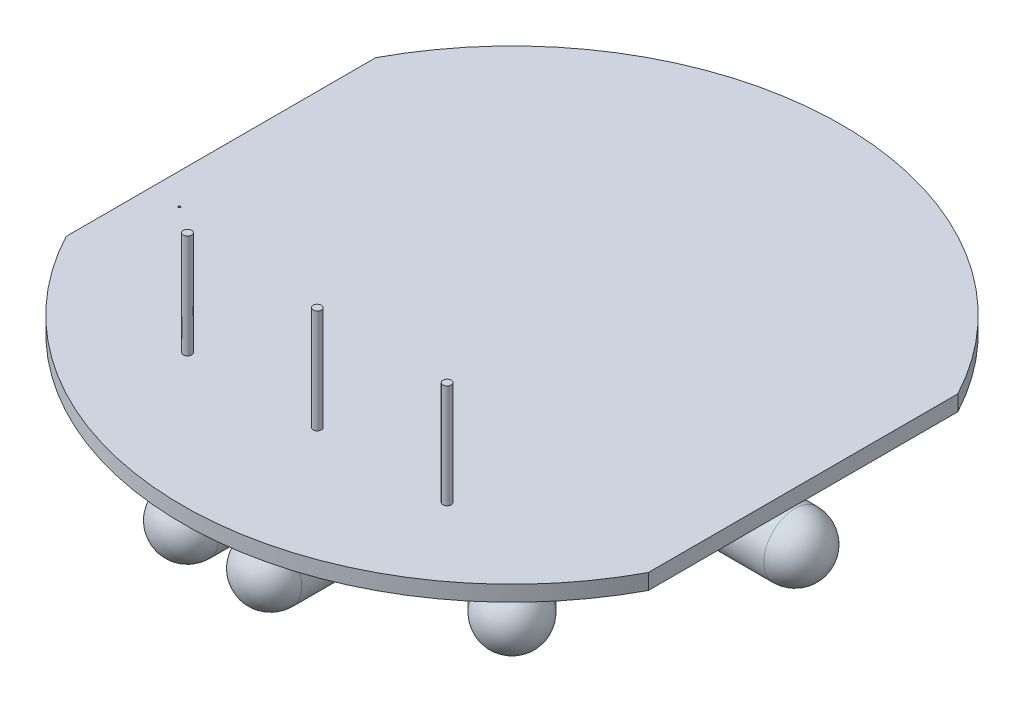
from build123d import *

# Parameters (mm, degrees)
SKETCH1_R        = 0.1075
BASE_DEPTH       = 1.5
SKETCH2_W        = 12.5
SKETCH2_H        = 4
MOTOR_BOX_DEPTH  = 4
FRONT_LEDS_COUNT = 2
FRONT_LEDS_PITCH = 8
SKETCH7_R        = 0.4
ANTENNAE_DEPTH   = 10


with BuildPart() as part:
    # Sketch1 → Base (new body)
    with BuildSketch(Plane(origin=(0, 0, 0), x_dir=(1, 0, 0), z_dir=(0, 1, 0))):
        with BuildLine():
            Line((-28.033586073, 14.905722118), (-28.033586073, -14.905722118))
            ThreePointArc((-28.033586073, -14.905722118), (0, -31.75), (28.033586073, -14.905722118))
            Line((28.033586073, -14.905722118), (28.033586073, 14.905722118))
            ThreePointArc((28.033586073, 14.905722118), (0, 31.75), (-28.033586073, 14.905722118))
        make_face()
        with Locations(Location((-25.04971545, -6.985, 0), (0, 0, 270))):
            Circle(SKETCH1_R, mode=Mode.SUBTRACT)
    extrude(amount=BASE_DEPTH)

    # Sketch2 → Motor Box (add)
    with BuildSketch(Plane.XZ):
        with Locations((0, 11.43)):
            Rectangle(SKETCH2_W, SKETCH2_H)
    extrude(amount=MOTOR_BOX_DEPTH)

    # Sketch7 → Antennae (add)
    with BuildSketch(Plane(origin=(0, 1.5, 0), x_dir=(-1, 0, 0), z_dir=(0, 1, 0))):
        with Locations(Location((0, 18.75, 0), (0, 0, 90))):
            Circle(SKETCH7_R)
        with Locations(Location((-12.5, 18.75, 0), (0, 0, 90))):
            Circle(SKETCH7_R)
        with Locations(Location((12.5, 18.75, 0), (0, 0, 90))):
            Circle(SKETCH7_R)
    extrude(amount=ANTENNAE_DEPTH)


with BuildPart() as body_2:
    # Sketch4 → LED (revolve)
    with BuildSketch(Plane(origin=(0, -4, 0), x_dir=(-1, 0, 0), z_dir=(0, 1, 0))):
        with BuildLine():
            Line((0, -21.75), (0, -30.25))
            ThreePointArc((0, -30.25), (-2.121320344, -29.371320344), (-3, -27.25))
            Line((-3, -27.25), (-3, -21.75))
            Line((-3, -21.75), (0, -21.75))
        make_face()
    revolve(axis=Axis((0, -4, -21.75), (0, 0, -1)))


with BuildPart() as body_3:
    # LED Pattern: read off the stored shape, not the designer's step
    # LED Pattern outline → LED Pattern (revolve)
    with BuildSketch(Plane(origin=(0, -4, 0), x_dir=(0.707106781186556, 0, -0.707106781186539), z_dir=(0, -1, 0))):
        with BuildLine():
            Line((3, -21.75), (0, -21.75))
            Line((0, -21.75), (0, -30.25))
            ThreePointArc((0, -30.25), (2.121320345, -29.371320342), (3, -27.249999997))
            Line((3, -27.249999997), (3, -21.75))
        make_face()
    revolve(axis=Axis((0, -4, 0), (0.707106781186539, 0, 0.707106781186556)))


with BuildPart() as body_4:
    # LED Pattern 2 outline → LED Pattern 2 (revolve)
    with BuildSketch(Plane(origin=(0, -4, 0), x_dir=(0, 1, 0), z_dir=(0, 0, -1))):
        with BuildLine():
            Line((3, -21.75), (0, -21.75))
            Line((0, -21.75), (0, -30.25))
            ThreePointArc((0, -30.25), (2.121320345, -29.371320342), (3, -27.249999997))
            Line((3, -27.249999997), (3, -21.75))
        make_face()
    revolve(axis=Axis((0, -4, 0), (1, 0, 0)))


with BuildPart() as body_5:
    # LED Pattern 3 outline → LED Pattern 3 (revolve)
    with BuildSketch(Plane(origin=(0, -4, 0), x_dir=(0.707106781186541, 0, 0.707106781186554), z_dir=(0, 1, 0))):
        with BuildLine():
            Line((3, -21.75), (0, -21.75))
            Line((0, -21.75), (0, -30.25))
            ThreePointArc((0, -30.25), (2.121320345, -29.371320342), (3, -27.249999997))
            Line((3, -27.249999997), (3, -21.75))
        make_face()
    revolve(axis=Axis((0, -4, 0), (0.707106781186554, 0, -0.707106781186541)))


with BuildPart() as body_6:
    # LED Pattern 4 outline → LED Pattern 4 (revolve)
    with BuildSketch(Plane(origin=(0, -4, 0), x_dir=(0.7071067811865509, 0, -0.707106781186544), z_dir=(0, -1, 0))):
        with BuildLine():
            Line((0, 30.25), (0, 21.75))
            Line((0, 21.75), (3, 21.75))
            Line((3, 21.75), (3, 27.249999997))
            ThreePointArc((3, 27.249999997), (2.121320345, 29.371320342), (0, 30.25))
        make_face()
    revolve(axis=Axis((0, -4, 0), (0.707106781186544, 0, 0.7071067811865509)))


with BuildPart() as body_7:
    # LED Pattern 5 outline → LED Pattern 5 (revolve)
    with BuildSketch(Plane(origin=(0, -4, 0), x_dir=(0, 1, 0), z_dir=(0, 0, -1))):
        with BuildLine():
            Line((0, 30.25), (0, 21.75))
            Line((0, 21.75), (3, 21.75))
            Line((3, 21.75), (3, 27.249999997))
            ThreePointArc((3, 27.249999997), (2.121320345, 29.371320342), (0, 30.25))
        make_face()
    revolve(axis=Axis((0, -4, 0), (1, 0, 0)))


with BuildPart() as body_8:
    # LED Pattern 6 outline → LED Pattern 6 (revolve)
    with BuildSketch(Plane(origin=(0, -4, 0), x_dir=(0.707106781186546, 0, 0.707106781186549), z_dir=(0, 1, 0))):
        with BuildLine():
            Line((0, 30.25), (0, 21.75))
            Line((0, 21.75), (3, 21.75))
            Line((3, 21.75), (3, 27.249999997))
            ThreePointArc((3, 27.249999997), (2.121320345, 29.371320342), (0, 30.25))
        make_face()
    revolve(axis=Axis((0, -4, 0), (0.707106781186549, 0, -0.707106781186546)))


with BuildPart() as body_9:
    # LED Pattern 7 outline → LED Pattern 7 (revolve)
    with BuildSketch(Plane.XZ.offset(4)):
        with BuildLine():
            Line((3, -21.75), (0, -21.75))
            Line((0, -21.75), (0, -30.25))
            ThreePointArc((0, -30.25), (2.121320345, -29.371320342), (3, -27.249999997))
            Line((3, -27.249999997), (3, -21.75))
        make_face()
    revolve(axis=Axis((0, -4, 0), (0, 0, 1)))


with BuildPart() as body_10:
    # Sketch6 → Front LED (revolve)
    with BuildSketch(Plane(origin=(0, -4, 0), x_dir=(-1, 0, 0), z_dir=(0, 1, 0)), mode=Mode.PRIVATE) as front_led_sk:
        with BuildLine():
            Line((-4, 21.75), (-4, 30.25))
            ThreePointArc((-4, 30.25), (-6.121320344, 29.371320344), (-7, 27.25))
            Line((-7, 27.25), (-7, 21.75))
            Line((-7, 21.75), (-4, 21.75))
        make_face()
    revolve(front_led_sk.sketch.rotate(Axis((4, -4, 21.75), (0, 0, 1)), 180), axis=Axis((4, -4, 21.75), (0, 0, 1)))


with BuildPart() as front_leds_1:
    # Front LEDs: pattern copy
    add(body_10.part.moved(Location(Vector(-1, 0, 0) * (1 * FRONT_LEDS_PITCH))))


solid = Compound([part.part, body_2.part, body_3.part, body_4.part, body_5.part, body_6.part, body_7.part, body_8.part, body_9.part, body_10.part, front_leds_1.part])
